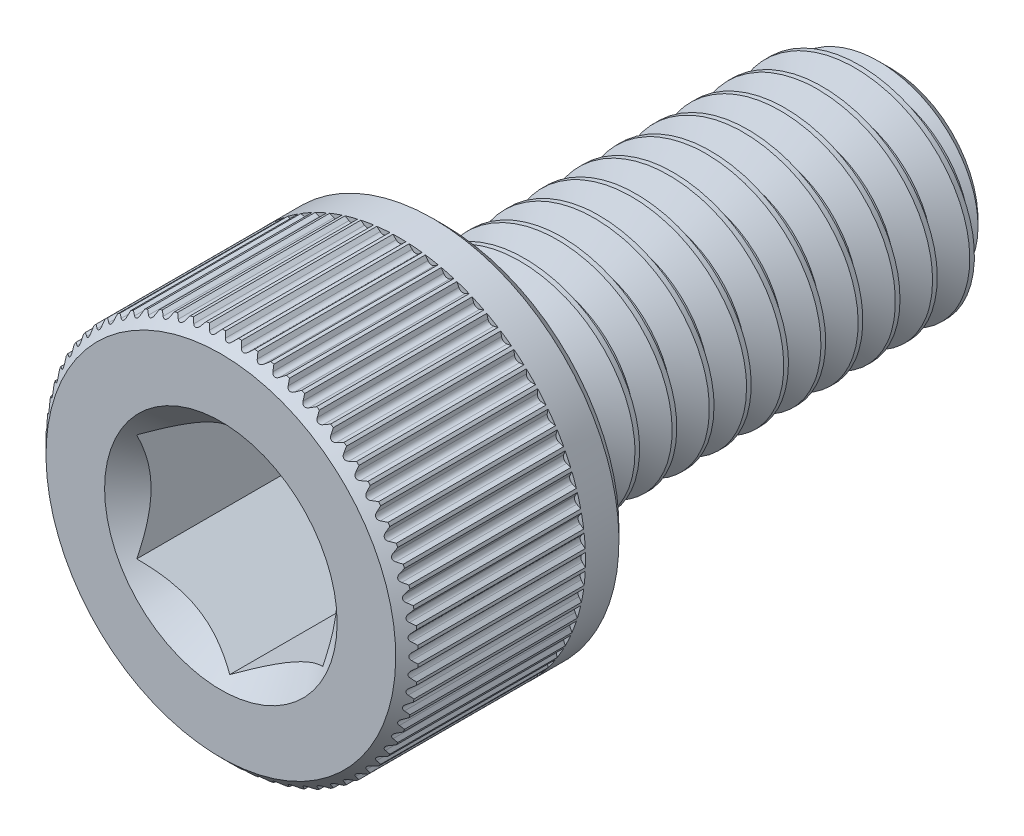
from build123d import *

# Parameters (mm, degrees)
CUT_EXTRUDE1_DEPTH     = 5
SKETCH4_R              = 3.125
CUT_EXTRUDE2_DEPTH     = 3
CUT_EXTRUDE2_DRAFT     = -45
SPLIT1_SURFACE_1_BACK  = 23.891
SPLIT1_SURFACE_1_DEPTH = 47.782
SPLIT1_SURFACE_2_BACK  = 23.891
SPLIT1_SURFACE_2_DEPTH = 47.782
CUT_SWEEP1_PITCH       = 1
CUT_EXTRUDE3_DEPTH     = 4.8
CIRPATTERN1_COUNT      = 72


with BuildPart() as part:
    # Sketch2 → Revolve1 (revolve)
    with BuildSketch(Plane(origin=(0, 0, 0), x_dir=(0, 0, -1), z_dir=(1, 0, 0))):
        with BuildLine():
            Line((-9, 0), (-9, 4.7))
            Line((-9, 4.7), (-8.7, 5))
            Line((-8.7, 5), (-3.3, 5))
            Line((-3.3, 5), (-3, 4.7))
            Line((-3, 4.7), (-3, 3.3))
            ThreePointArc((-3, 3.3), (-2.912132034, 3.087867966), (-2.7, 3))
            Line((-2.7, 3), (8.350480947, 3))
            Line((8.350480947, 3), (9, 2.350480947))
            Line((9, 2.350480947), (9, 0))
            Line((9, 0), (-9, 0))
        make_face()
    revolve(axis=Axis((0, 0, -9), (0, 0, 1)))

    # Sketch3 → Cut-Extrude1 (cut)
    with BuildSketch(Plane.XY.offset(9)):
        Polygon((2.5, -1.443375673), (2.5, 1.443375673), (0, 2.886751346), (-2.5, 1.443375673), (-2.5, -1.443375673), (0, -2.886751346), align=None)
    extrude(amount=-CUT_EXTRUDE1_DEPTH, mode=Mode.SUBTRACT)


with BuildPart() as cut_extrude2_tool:
    # Sketch4 → Cut-Extrude2 (with draft: the straight prism first)
    with BuildSketch(Plane.XY.offset(9)):
        Circle(SKETCH4_R)
    extrude(amount=-CUT_EXTRUDE2_DEPTH)
    # Cut-Extrude2: the draft: its side faces are tilted about the plane it starts from
    cut_extrude2_sides = [cut_extrude2_tool.faces().sort_by_distance(p)[0] for p in [
        (-3.125, 0, 7.5),
    ]]
    draft(cut_extrude2_sides, Plane.XY.offset(9), CUT_EXTRUDE2_DRAFT)


with BuildPart() as part_1:
    add(part.part)

    # Cut-Extrude2: cut by cut_extrude2_tool
    add(cut_extrude2_tool.part, mode=Mode.SUBTRACT)


with BuildPart() as body_2:
    # Split1: the piece behind the surface
    add(part_1.part)
    # Split1 surface: a surface, the sketch's curves swept straight by 47.782 mm
    with BuildLine(Plane(origin=(0, 0, 0), x_dir=(0, 0, -1), z_dir=(1, 0, 0)).offset(-SPLIT1_SURFACE_1_BACK), mode=Mode.PRIVATE) as split1_surface_1_path:
        Line((-2.7, -5), (-2.7, 5))
    split1_surface_1 = Shell.extrude(split1_surface_1_path.wire(), (1 * SPLIT1_SURFACE_1_DEPTH, 0 * SPLIT1_SURFACE_1_DEPTH, 0 * SPLIT1_SURFACE_1_DEPTH))
    split(bisect_by=split1_surface_1, keep=Keep.BOTTOM)

    # Cut-Sweep1: the profile of Sketch7 screwed along a right-hand helix of 13 turns, 8 arcs to a turn; built about Z, then put on its axis
    cut_sweep1_z = Axis((0, 0, 0), (0, 0, 1))
    cut_sweep1_corners = [(3.054126588, 0, 0.03125), (3.054126588, 0, -0.90625), (2.350480947, 0, -0.5), (2.350480947, 0, -0.375)]
    with BuildLine(mode=Mode.PRIVATE) as cut_sweep1_profile:
        Line(cut_sweep1_corners[0], cut_sweep1_corners[1])
        Line(cut_sweep1_corners[1], cut_sweep1_corners[2])
        Line(cut_sweep1_corners[2], cut_sweep1_corners[3])
        Line(cut_sweep1_corners[3], cut_sweep1_corners[0])
    cut_sweep1_cap = Face(cut_sweep1_profile.wire())
    cut_sweep1_turn_angles = [0, 22.5, 45, 67.5, 90, 112.5, 135, 157.5, 180, 202.5, 225, 247.5, 270, 292.5, 315, 337.5, 360]
    cut_sweep1_turn_weights = [1, 0.9238795325112867, 1, 0.9238795325112867, 1, 0.9238795325112867, 1, 0.9238795325112867, 1, 0.9238795325112867, 1, 0.9238795325112867, 1, 0.9238795325112867, 1, 0.9238795325112867, 1]
    cut_sweep1_turn_rails = [Edge.make_bspline([Vector(p[0], p[1], 0).rotate(cut_sweep1_z, cut_sweep1_turn_angles[k]) / cut_sweep1_turn_weights[k] + Vector(0, 0, p[2] + CUT_SWEEP1_PITCH * cut_sweep1_turn_angles[k] / 360) for k in range(17)], [0, 0, 0, 1, 1, 2, 2, 3, 3, 4, 4, 5, 5, 6, 6, 7, 7, 8, 8, 8], 2, cut_sweep1_turn_weights) for p in cut_sweep1_corners]
    cut_sweep1_turn_sides = [Face.make_surface_from_curves(cut_sweep1_turn_rails[p[0]], cut_sweep1_turn_rails[p[1]]) for p in [(0, 1), (1, 2), (2, 3), (3, 0)]]
    cut_sweep1 = Plane(origin=(0, 0, -9), x_dir=(0, 1, 0), z_dir=(0, 0, 1)) * Solid(Shell([*[p.moved(Location((0, 0, CUT_SWEEP1_PITCH * i))) for i in range(13) for p in cut_sweep1_turn_sides], cut_sweep1_cap, cut_sweep1_cap.rotate(cut_sweep1_z, 4680).moved(Location((0, 0, CUT_SWEEP1_PITCH * 4680 / 360)))]))
    add(cut_sweep1, mode=Mode.SUBTRACT)


with BuildPart() as part_2:
    add(part_1.part)

    # Split1: split by a surface, the side it looks to stays
    # Split1 surface: a surface, the sketch's curves swept straight by 47.782 mm
    with BuildLine(Plane(origin=(0, 0, 0), x_dir=(0, 0, -1), z_dir=(1, 0, 0)).offset(-SPLIT1_SURFACE_2_BACK), mode=Mode.PRIVATE) as split1_surface_2_path:
        Line((-2.7, -5), (-2.7, 5))
    split1_surface_2 = Shell.extrude(split1_surface_2_path.wire(), (1 * SPLIT1_SURFACE_2_DEPTH, 0 * SPLIT1_SURFACE_2_DEPTH, 0 * SPLIT1_SURFACE_2_DEPTH))
    split(bisect_by=split1_surface_2, keep=Keep.TOP)

    add(body_2.part)  # Revolve2 merges body 2
    # Sketch8 → Revolve2 (revolve)
    with BuildSketch(Plane(origin=(0, 0, 0), x_dir=(0, 0, -1), z_dir=(1, 0, 0))):
        Polygon((-3, 0), (-3, 3), (-2.7, 3), (-0.967949192, 0), align=None)
    revolve(axis=Axis((0, 0, 0.967949192), (0, 0, 1)))

    # Sketch12 → Cut-Extrude3 (cut)
    with BuildSketch(Plane.XY.offset(9)):
        with BuildLine():
            Line((-0.302543348, 5.125), (0.302543348, 5.125))
            Line((0.302543348, 5.125), (0.089697106, 4.912153758))
            ThreePointArc((0.089697106, 4.912153758), (0, 4.875), (-0.089697106, 4.912153758))
            Line((-0.089697106, 4.912153758), (-0.302543348, 5.125))
        make_face()
    cut_extrude3 = extrude(amount=-CUT_EXTRUDE3_DEPTH, mode=Mode.SUBTRACT)

    # CirPattern1: Cut-Extrude3 ×72 about axis
    cirpattern1_axis = Axis((0, 0, 0), (0, 0, 1))
    for i in range(1, CIRPATTERN1_COUNT):
        add(cut_extrude3.rotate(cirpattern1_axis, i * 360 / CIRPATTERN1_COUNT), mode=Mode.SUBTRACT)


solid = part_2.part
